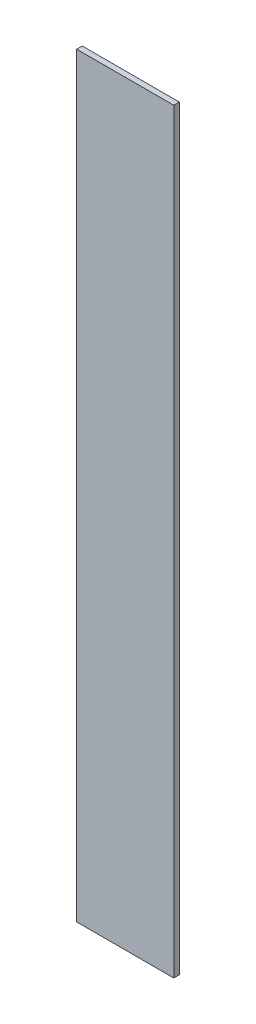
from build123d import *

# Parameters (mm, degrees)
SKETCH1_W           = 28
SKETCH1_H           = 218
BOSS_EXTRUDE1_DEPTH = 1.6


with BuildPart() as part:
    # Sketch1 → Boss-Extrude1 (new body)
    with BuildSketch(Plane.XY):
        with Locations((0, 109)):
            Rectangle(SKETCH1_W, SKETCH1_H)
    extrude(amount=BOSS_EXTRUDE1_DEPTH)


solid = part.part
